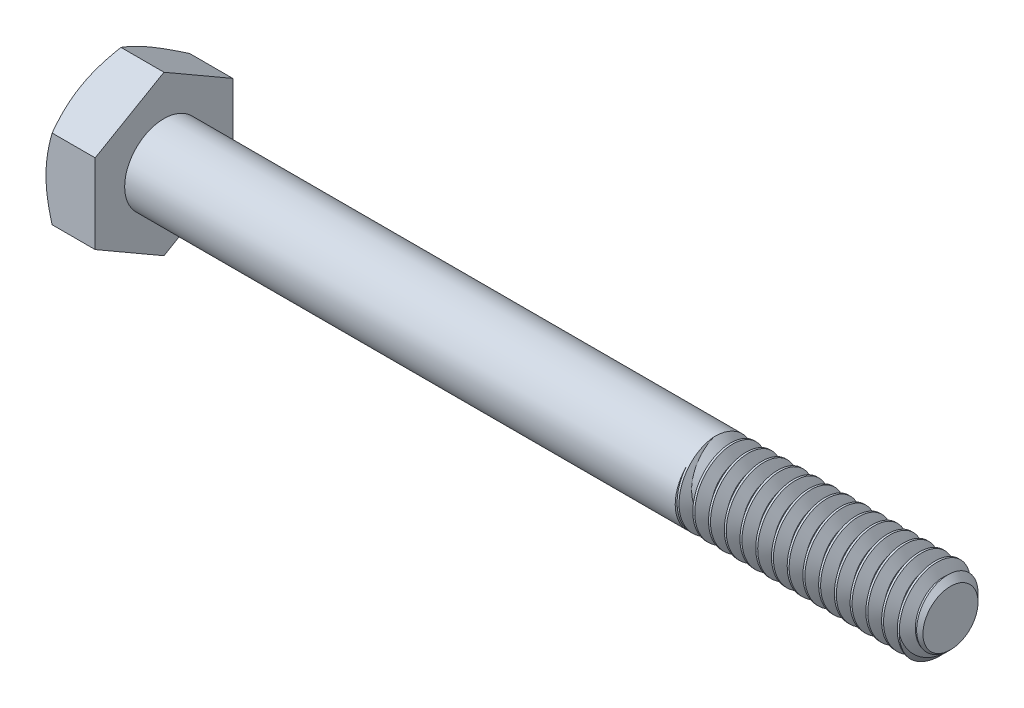
from build123d import *

# Parameters (mm, degrees)
SKETCH5_R           = 3.175
BOSS_EXTRUDE3_DEPTH = 63.5
CHAMFER1_SIZE       = 0.9525
CUT_SWEEP1_PITCH    = 1.27
BOSS_EXTRUDE4_DEPTH = 3.96875
SKETCH8_OUTSIDE_W   = 266.05
SKETCH8_OUTSIDE_H   = 267.77
SKETCH8_OUTSIDE_R   = 5.55625
CUT_EXTRUDE3_DEPTH  = 69.000490485
CUT_EXTRUDE3_DRAFT  = -60


with BuildPart() as part:
    # Sketch5 → Boss-Extrude3 (new body)
    with BuildSketch(Plane(origin=(33.734375, 0, 0), x_dir=(0, 0, -1), z_dir=(1, 0, 0))):
        Circle(SKETCH5_R)
    extrude(amount=-BOSS_EXTRUDE3_DEPTH)

    # Chamfer1
    chamfer1_edges = [part.edges().sort_by_distance(p)[0] for p in [
        (33.734375, 0, 3.175),
    ]]
    chamfer(chamfer1_edges, length=CHAMFER1_SIZE)

    # Cut-Sweep1: the profile of Sketch10 profile screwed along a right-hand helix of 16 turns, 8 arcs to a turn; built about Z, then put on its axis
    cut_sweep1_z = Axis((0, 0, 0), (0, 0, 1))
    cut_sweep1_corners = [(3.1753, 0, 0.000173205), (2.350110803, 0, -0.47625), (2.350110803, 0, -0.635), (3.1753, 0, -1.111423205)]
    with BuildLine(mode=Mode.PRIVATE) as cut_sweep1_profile:
        Line(cut_sweep1_corners[0], cut_sweep1_corners[1])
        Line(cut_sweep1_corners[1], cut_sweep1_corners[2])
        Line(cut_sweep1_corners[2], cut_sweep1_corners[3])
        Line(cut_sweep1_corners[3], cut_sweep1_corners[0])
    cut_sweep1_cap = Face(cut_sweep1_profile.wire())
    cut_sweep1_turn_angles = [0, 22.5, 45, 67.5, 90, 112.5, 135, 157.5, 180, 202.5, 225, 247.5, 270, 292.5, 315, 337.5, 360]
    cut_sweep1_turn_weights = [1, 0.9238795325112867, 1, 0.9238795325112867, 1, 0.9238795325112867, 1, 0.9238795325112867, 1, 0.9238795325112867, 1, 0.9238795325112867, 1, 0.9238795325112867, 1, 0.9238795325112867, 1]
    cut_sweep1_turn_rails = [Edge.make_bspline([Vector(p[0], p[1], 0).rotate(cut_sweep1_z, cut_sweep1_turn_angles[k]) / cut_sweep1_turn_weights[k] + Vector(0, 0, p[2] + CUT_SWEEP1_PITCH * cut_sweep1_turn_angles[k] / 360) for k in range(17)], [0, 0, 0, 1, 1, 2, 2, 3, 3, 4, 4, 5, 5, 6, 6, 7, 7, 8, 8, 8], 2, cut_sweep1_turn_weights) for p in cut_sweep1_corners]
    cut_sweep1_turn_sides = [Face.make_surface_from_curves(cut_sweep1_turn_rails[p[0]], cut_sweep1_turn_rails[p[1]]) for p in [(0, 1), (1, 2), (2, 3), (3, 0)]]
    cut_sweep1 = Plane(origin=(33.734375, 0, 0), x_dir=(0, 1, 0), z_dir=(-1, 0, 0)) * Solid(Shell([*[p.moved(Location((0, 0, CUT_SWEEP1_PITCH * i))) for i in range(16) for p in cut_sweep1_turn_sides], cut_sweep1_cap, cut_sweep1_cap.rotate(cut_sweep1_z, 5760).moved(Location((0, 0, CUT_SWEEP1_PITCH * 5760 / 360)))]))
    add(cut_sweep1, mode=Mode.SUBTRACT)

    # Sketch11 → Revolve1 (revolve)
    with BuildSketch(Plane.XY, mode=Mode.PRIVATE) as revolve1_sk:
        Polygon((-29.765625, 3.175), (-29.765625, 0), (17.859375, 0), (14.684375, 3.175), align=None)
    revolve(revolve1_sk.sketch.rotate(Axis((-29.765625, 0, 0), (1, 0, 0)), 270), axis=Axis((-29.765625, 0, 0), (1, 0, 0)))

    # Sketch6 → Boss-Extrude4 (add)
    with BuildSketch(Plane.ZY.offset(29.765625)):
        Polygon((5.55625, 3.207902433), (0, 6.415804866), (-5.55625, 3.207902433), (-5.55625, -3.207902433), (0, -6.415804866), (5.55625, -3.207902433), align=None)
    extrude(amount=BOSS_EXTRUDE4_DEPTH)


with BuildPart() as cut_extrude3_tool:
    # Sketch8 outside → Cut-Extrude3 (with draft: the straight prism first)
    with BuildSketch(Plane.ZY.offset(33.734375)):
        Rectangle(SKETCH8_OUTSIDE_W, SKETCH8_OUTSIDE_H)
        Circle(SKETCH8_OUTSIDE_R, mode=Mode.SUBTRACT)
    extrude(amount=-CUT_EXTRUDE3_DEPTH)
    # Cut-Extrude3: the draft: its side faces are tilted about the plane it starts from
    cut_extrude3_sides = [cut_extrude3_tool.faces().sort_by_distance(p)[0] for p in [
        (0.765870243, -133.885, 0),
        (0.765870243, 0, 133.025),
        (0.765870243, 133.885, 0),
        (0.765870243, 0, -133.025),
        (0.765870243, 0, -5.55625),
    ]]
    draft(cut_extrude3_sides, Plane.ZY.offset(33.734375), CUT_EXTRUDE3_DRAFT)


with BuildPart() as part_1:
    add(part.part)

    # Cut-Extrude3: cut by cut_extrude3_tool
    add(cut_extrude3_tool.part, mode=Mode.SUBTRACT)


solid = part_1.part
